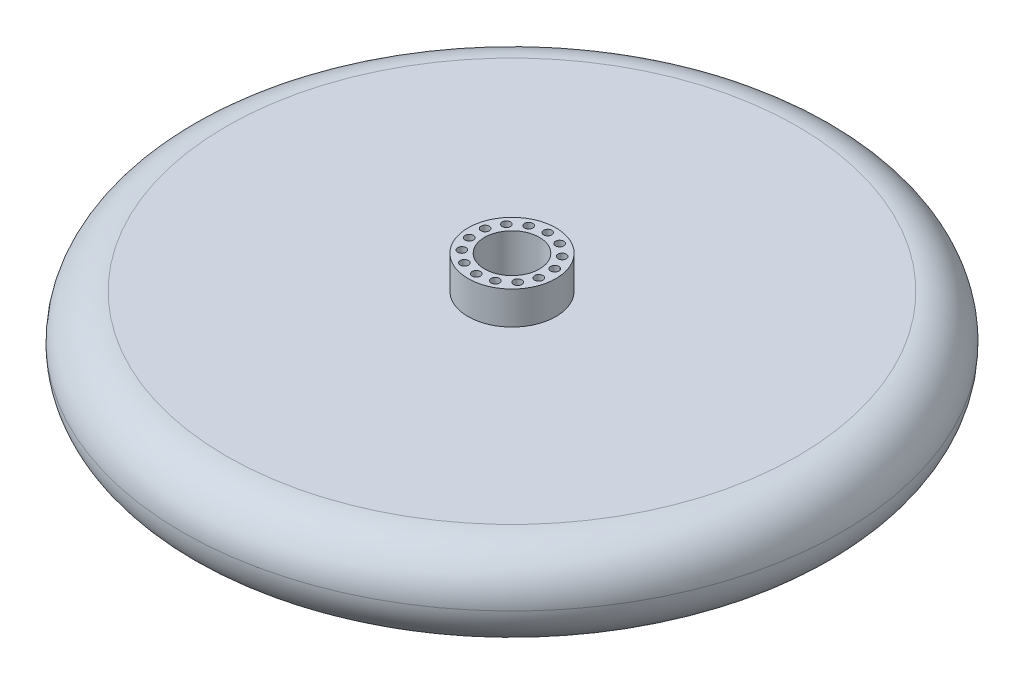
from build123d import *

# Parameters (mm, degrees)
BOSS_EXTRUDE5_DEPTH      = 69.85
BOSS_EXTRUDE5_DEPTH_BACK = 19.05
SKETCH1_R                = 25.4
SKETCH1_R_2              = 2.38125
SKETCH1_R_3              = 15.875
SKETCH2_R                = 190.5
SKETCH2_R_2              = 25.4
BOSS_EXTRUDE7_DEPTH      = 69.85
SKETCH4_R                = 190.5
SKETCH4_R_2              = 25.4
CUT_EXTRUDE2_DEPTH       = 19.05
FILLET1_R                = 25.4


with BuildPart() as part:
    # Sketch1 → Boss-Extrude5 (new, two sides: drawn at the far end of the back side and taken through both)
    with BuildSketch(Plane(origin=(0, 0, 0), x_dir=(1, 0, 0), z_dir=(0, 1, 0)).offset(-BOSS_EXTRUDE5_DEPTH_BACK)):
        with Locations(Location((0, 0, 0), (0, 0, 270))):
            Circle(SKETCH1_R)
        with Locations(Location((-8.954275666, 18.593745011, 0), (0, 0, 270))):
            Circle(SKETCH1_R_2, mode=Mode.SUBTRACT)
        with Locations(Location((-16.135047219, 12.867270786, 0), (0, 0, 270))):
            Circle(SKETCH1_R_2, mode=Mode.SUBTRACT)
        with Locations(Location((-20.120074788, 4.592275775, 0), (0, 0, 270))):
            Circle(SKETCH1_R_2, mode=Mode.SUBTRACT)
        with Locations(Location((-20.120074788, -4.592275775, 0), (0, 0, 270))):
            Circle(SKETCH1_R_2, mode=Mode.SUBTRACT)
        with Locations(Location((-16.135047219, -12.867270786, 0), (0, 0, 270))):
            Circle(SKETCH1_R_2, mode=Mode.SUBTRACT)
        with Locations(Location((-8.954275666, -18.593745011, 0), (0, 0, 270))):
            Circle(SKETCH1_R_2, mode=Mode.SUBTRACT)
        with Locations(Location((0, -20.6375, 0), (0, 0, 270))):
            Circle(SKETCH1_R_2, mode=Mode.SUBTRACT)
        with Locations(Location((8.954275666, -18.593745011, 0), (0, 0, 270))):
            Circle(SKETCH1_R_2, mode=Mode.SUBTRACT)
        with Locations(Location((16.135047219, -12.867270786, 0), (0, 0, 270))):
            Circle(SKETCH1_R_2, mode=Mode.SUBTRACT)
        with Locations(Location((20.120074788, -4.592275775, 0), (0, 0, 270))):
            Circle(SKETCH1_R_2, mode=Mode.SUBTRACT)
        with Locations(Location((20.120074788, 4.592275775, 0), (0, 0, 270))):
            Circle(SKETCH1_R_2, mode=Mode.SUBTRACT)
        with Locations(Location((16.135047219, 12.867270786, 0), (0, 0, 270))):
            Circle(SKETCH1_R_2, mode=Mode.SUBTRACT)
        with Locations(Location((8.954275666, 18.593745011, 0), (0, 0, 270))):
            Circle(SKETCH1_R_2, mode=Mode.SUBTRACT)
        with Locations(Location((0, 20.6375, 0), (0, 0, 270))):
            Circle(SKETCH1_R_2, mode=Mode.SUBTRACT)
        with Locations(Location((0, 0, 0), (0, 0, 270))):
            Circle(SKETCH1_R_3, mode=Mode.SUBTRACT)
    extrude(amount=BOSS_EXTRUDE5_DEPTH + BOSS_EXTRUDE5_DEPTH_BACK)

    # Sketch2 → Boss-Extrude7 (add)
    with BuildSketch(Plane(origin=(0, -19.05, 0), x_dir=(-1, 0, 0), z_dir=(0, -1, 0))):
        with Locations(Location((0, 0, 0), (0, 0, 90))):
            Circle(SKETCH2_R)
        with Locations(Location((0, 0, 0), (0, 0, 270))):
            Circle(SKETCH2_R_2, mode=Mode.SUBTRACT)
    extrude(amount=-BOSS_EXTRUDE7_DEPTH)

    # Sketch4 → Cut-Extrude2 (cut)
    with BuildSketch(Plane(origin=(0, -19.05, 0), x_dir=(-1, 0, 0), z_dir=(0, -1, 0))):
        with Locations(Location((0, 0, 0), (0, 0, 90))):
            Circle(SKETCH4_R)
        with Locations(Location((0, 0, 0), (0, 0, 270))):
            Circle(SKETCH4_R_2, mode=Mode.SUBTRACT)
    extrude(amount=-CUT_EXTRUDE2_DEPTH, mode=Mode.SUBTRACT)

    # Fillet1
    fillet1_edges = [part.edges().sort_by_distance(p)[0] for p in [
        (0, 50.8, 190.5),
        (0, 0, 190.5),
    ]]
    fillet(fillet1_edges, radius=FILLET1_R - 0.0001)  # a hair under: the kernel refuses the full size


solid = part.part
